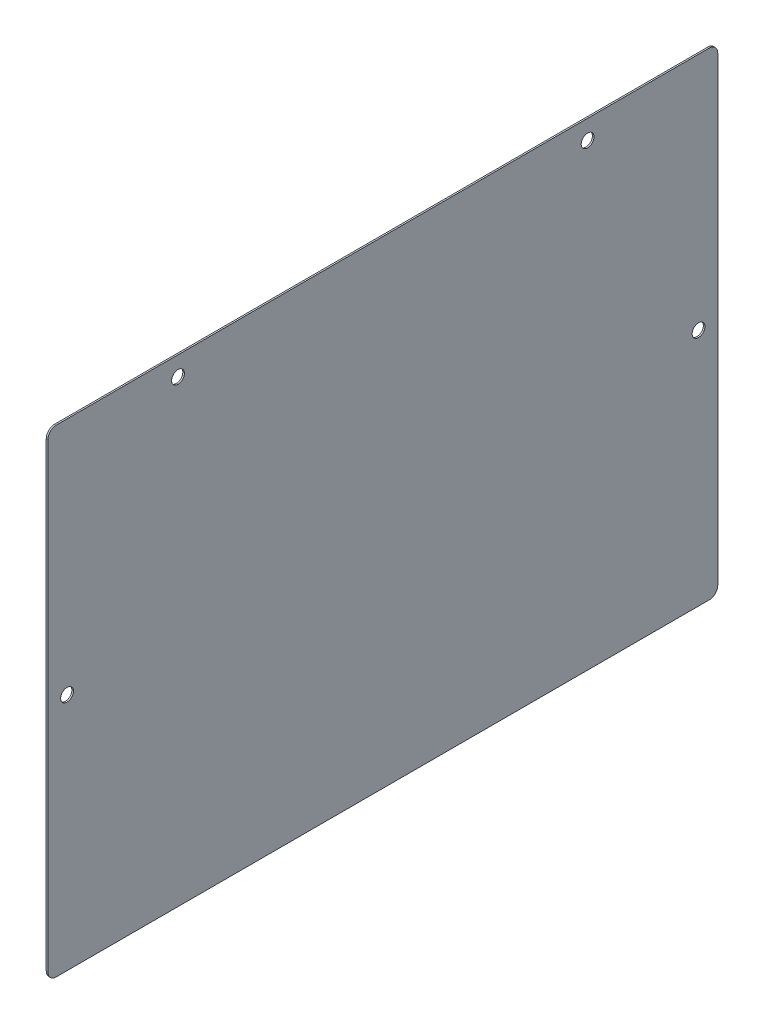
from build123d import *

# Parameters (mm, degrees)
SKETCH1_W          = 498.475
SKETCH1_H          = 355.6
BASE_FLANGE1_DEPTH = 1.1938
CUT_EXTRUDE1_REACH = 308.159
SKETCH6_R          = 4.7625
FILLET1_R          = 6.35


# Sheet-metal steps are written as plain solids
with BuildPart() as part:
    # Sketch1 → Base-Flange1 (new body)
    with BuildSketch(Plane(origin=(0, 0, 0), x_dir=(0, 0, -1), z_dir=(1, 0, 0))):
        Rectangle(SKETCH1_W, SKETCH1_H)
    extrude(amount=-BASE_FLANGE1_DEPTH)

    # Sketch6 → Cut-Extrude1 (cut, up to next)
    with BuildSketch(Plane(origin=(0, 0, 0), x_dir=(0, 0, -1), z_dir=(1, 0, 0)), mode=Mode.PRIVATE) as cut_extrude1_sk1:
        with Locations((-152.4, 163.5125)):
            Circle(SKETCH6_R)
    cut_extrude1_tool1 = extrude(cut_extrude1_sk1.sketch, amount=-CUT_EXTRUDE1_REACH, mode=Mode.PRIVATE) & part.part
    # Sketch6 → Cut-Extrude1 (cut, up to next)
    with BuildSketch(Plane(origin=(0, 0, 0), x_dir=(0, 0, -1), z_dir=(1, 0, 0)), mode=Mode.PRIVATE) as cut_extrude1_sk2:
        with Locations((-234.95, 0)):
            Circle(SKETCH6_R)
    cut_extrude1_tool2 = extrude(cut_extrude1_sk2.sketch, amount=-CUT_EXTRUDE1_REACH, mode=Mode.PRIVATE) & part.part
    cut_extrude1_1 = cut_extrude1_tool1.solids().sort_by_distance((0, 163.5125, 152.4))[0]
    add(cut_extrude1_1, mode=Mode.SUBTRACT)
    cut_extrude1_2 = cut_extrude1_tool2.solids().sort_by_distance((0, 0, 234.95))[0]
    add(cut_extrude1_2, mode=Mode.SUBTRACT)
    cut_extrude1 = cut_extrude1_1 + cut_extrude1_2  # Cut-Extrude1 as one shape, for the pattern or mirror that repeats it

    # Mirror1: Cut-Extrude1 across plane
    add(cut_extrude1.mirror(Plane.XY), mode=Mode.SUBTRACT)

    # Fillet1
    fillet1_edges = [part.edges().sort_by_distance(p)[0] for p in [
        (-0.5969, 177.8, 249.2375),
        (-0.5969, 177.8, -249.2375),
        (-0.5969, -177.8, -249.2375),
        (-0.5969, -177.8, 249.2375),
    ]]
    fillet(fillet1_edges, radius=FILLET1_R)


solid = part.part
